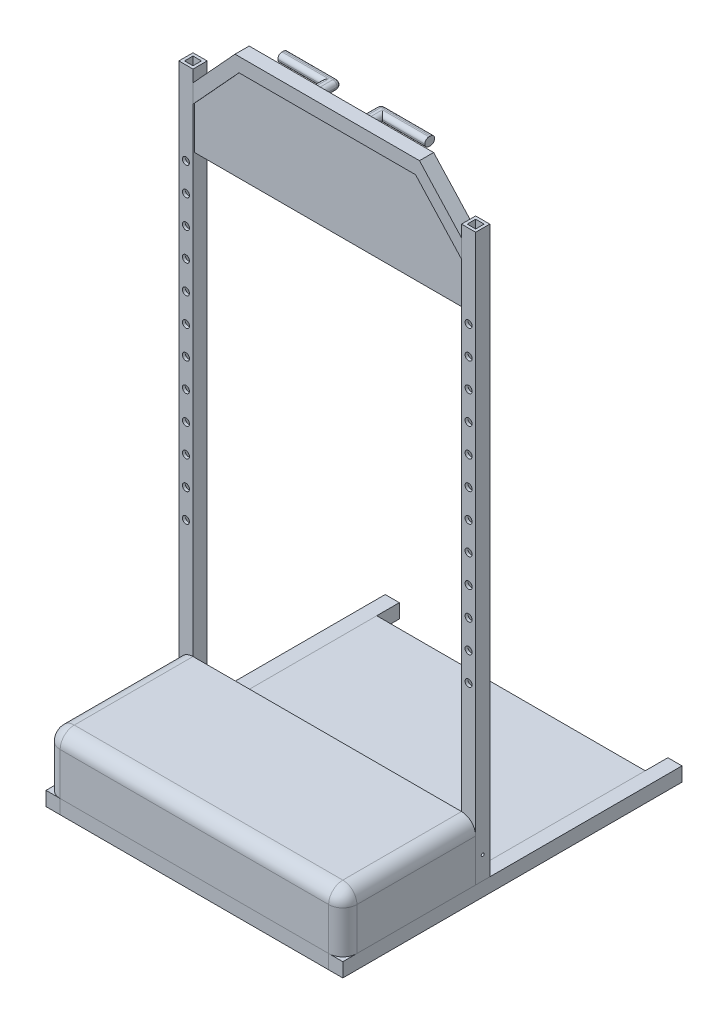
from build123d import *

# Parameters (mm, degrees)
SKETCH1_W               = 50
SKETCH1_H               = 1200
BOSS_EXTRUDE1_DEPTH     = 50
BOSS_EXTRUDE1_2_DEPTH   = 50
SKETCH2_W               = 950
SKETCH2_H               = 50
BOSS_EXTRUDE2_DEPTH     = 50
SKETCH3_W               = 50
SKETCH3_H               = 50
BOSS_EXTRUDE3_DEPTH     = 2000
BOSS_EXTRUDE3_2_DEPTH   = 2000
BOSS_EXTRUDE4_DEPTH     = 50
SKETCH8_W               = 30
SKETCH8_H               = 30
CUT_EXTRUDE1_DEPTH      = 1980
SKETCH9_W               = 1050
SKETCH9_H               = 470
BOSS_EXTRUDE5_DEPTH     = 200
SKETCH10_W              = 950
SKETCH10_H              = 50
BOSS_EXTRUDE7_DEPTH     = 320
SKETCH11_W              = 950
SKETCH11_H              = 50
BOSS_EXTRUDE8_DEPTH     = 100
FILLET1_R               = 50
FILLET2_R               = 50
FILLET3_R               = 50
SKETCH15_R              = 12.5
CUT_EXTRUDE4_DEPTH      = 50
BOSS_EXTRUDE13_DEPTH    = 45
SKETCH19_R              = 13.872950016
BOSS_EXTRUDE14_DEPTH    = 10
SKETCH19_R_2            = 11.261714239
BOSS_EXTRUDE14_2_DEPTH  = 10
SKETCH19_R_3            = 12.095962235
BOSS_EXTRUDE14_3_DEPTH  = 10
SKETCH19_R_4            = 25.497629654
SKETCH19_R_5            = 12.851526445
BOSS_EXTRUDE14_4_DEPTH  = 10
BOSS_EXTRUDE14_5_DEPTH  = 10
SKETCH19_W              = 28.160353525
SKETCH19_H              = 76.692026621
BOSS_EXTRUDE14_6_DEPTH  = 10
BOSS_EXTRUDE14_7_DEPTH  = 10
BOSS_EXTRUDE14_8_DEPTH  = 10
BOSS_EXTRUDE14_9_DEPTH  = 10
BOSS_EXTRUDE14_10_DEPTH = 10
BOSS_EXTRUDE14_11_DEPTH = 10
BOSS_EXTRUDE14_12_DEPTH = 10
BOSS_EXTRUDE14_13_DEPTH = 10
SKETCH19_W_2            = 9.553902
SKETCH19_H_2            = 46.983083585
BOSS_EXTRUDE14_14_DEPTH = 10
SKETCH25_W              = 40
SKETCH25_H              = 30
BOSS_EXTRUDE23_DEPTH    = 70
SKETCH28_W              = 35
SKETCH28_H              = 30
BOSS_EXTRUDE24_DEPTH    = 150
SKETCH29_W              = 35
SKETCH29_H              = 30
BOSS_EXTRUDE25_DEPTH    = 150
FILLET4_R               = 15
FILLET5_R               = 15
FILLET6_R               = 15
SKETCH30_W              = 25
SKETCH30_H              = 110
CUT_EXTRUDE5_DEPTH      = 100
SKETCH31_R              = 5.25
CUT_EXTRUDE6_DEPTH      = 55
SKETCH32_R              = 5.25
CUT_EXTRUDE7_DEPTH      = 55
SKETCH38_W              = 950
SKETCH38_H              = 650
BOSS_EXTRUDE31_DEPTH    = 35
SKETCH39_W              = 950
SKETCH39_H              = 650
BOSS_EXTRUDE33_DEPTH    = 15


# Some blends are built 0.0001 mm under size
with BuildPart() as part:
    # Sketch1 → Boss-Extrude1 (new body)
    with BuildSketch(Plane(origin=(0, 0, 0), x_dir=(1, 0, 0), z_dir=(0, 1, 0))):
        with Locations((-500, -551.538461538)):
            Rectangle(SKETCH1_W, SKETCH1_H)
    extrude(amount=BOSS_EXTRUDE1_DEPTH)


with BuildPart() as body_2:
    # Sketch1 → Boss-Extrude1 2 (new body)
    with BuildSketch(Plane(origin=(0, 0, 0), x_dir=(1, 0, 0), z_dir=(0, 1, 0))):
        with Locations((500, -551.538461538)):
            Rectangle(SKETCH1_W, SKETCH1_H)
    extrude(amount=BOSS_EXTRUDE1_2_DEPTH)


with BuildPart() as body_3:
    # Sketch2 → Boss-Extrude2 (new body)
    with BuildSketch(Plane.XZ):
        with Locations((0, 1026.538461538)):
            Rectangle(SKETCH2_W, SKETCH2_H)
    extrude(amount=-BOSS_EXTRUDE2_DEPTH)


with BuildPart() as body_4:
    # Sketch3 → Boss-Extrude3 (new body)
    with BuildSketch(Plane(origin=(0, 50, 0), x_dir=(1, 0, 0), z_dir=(0, 1, 0))):
        with Locations((-500, -656.538461538)):
            Rectangle(SKETCH3_W, SKETCH3_H)
    extrude(amount=BOSS_EXTRUDE3_DEPTH)


with BuildPart() as body_5:
    # Sketch3 → Boss-Extrude3 2 (new body)
    with BuildSketch(Plane(origin=(0, 50, 0), x_dir=(1, 0, 0), z_dir=(0, 1, 0))):
        with Locations((500, -656.538461538)):
            Rectangle(SKETCH3_W, SKETCH3_H)
    extrude(amount=BOSS_EXTRUDE3_2_DEPTH)


with BuildPart() as body_6:
    # Sketch6 → Boss-Extrude4 (new body)
    with BuildSketch(Plane(origin=(0, 0, 631.538461538), x_dir=(-1, 0, 0), z_dir=(0, 0, -1))):
        Polygon((475, 1942.633491709), (430.549586456, 1991.125611566), (312.41658097, 2120), (-312.431209368, 2120), (-442.530900604, 1978.058069606), (-475, 1942.633491709), (-475, 2007.818266571), (-326.349115906, 2170), (326.349115906, 2170), (475, 2007.818266571), align=None)
    extrude(amount=-BOSS_EXTRUDE4_DEPTH)

    # Sketch25 → Boss-Extrude23 (add)
    with BuildSketch(Plane(origin=(0, 0, 631.538461538), x_dir=(-1, 0, 0), z_dir=(0, 0, -1))):
        with Locations((-90.0036571, 2145)):
            Rectangle(SKETCH25_W, SKETCH25_H)
        with Locations((89.9963429, 2145)):
            Rectangle(SKETCH25_W, SKETCH25_H)
    extrude(amount=BOSS_EXTRUDE23_DEPTH)

    # Sketch28 → Boss-Extrude24 (add)
    with BuildSketch(Plane(origin=(110.0036571, 0, 0), x_dir=(0, 0, -1), z_dir=(1, 0, 0))):
        with Locations((-579.038461538, 2145)):
            Rectangle(SKETCH28_W, SKETCH28_H)
    extrude(amount=BOSS_EXTRUDE24_DEPTH)

    # Sketch29 → Boss-Extrude25 (add)
    with BuildSketch(Plane.ZY.offset(109.9963429)):
        with Locations((579.038461538, 2145)):
            Rectangle(SKETCH29_W, SKETCH29_H)
    extrude(amount=BOSS_EXTRUDE25_DEPTH)

    # Fillet4
    fillet4_edges = [body_6.edges().sort_by_distance(p)[0] for p in [
        (-109.9963429, 2130, 614.038461538),
        (-69.9963429, 2130, 596.538461538),
        (110.0036571, 2130, 614.038461538),
        (-69.9963429, 2160, 596.538461538),
        (-109.9963429, 2160, 614.038461538),
        (110.0036571, 2160, 614.038461538),
        (70.0036571, 2130, 596.538461538),
        (70.0036571, 2160, 596.538461538),
        (-184.9963429, 2160, 596.538461538),
        (-184.9963429, 2130, 596.538461538),
        (-164.9963429, 2130, 561.538461538),
        (-164.9963429, 2160, 561.538461538),
        (185.0036571, 2130, 596.538461538),
        (185.0036571, 2160, 596.538461538),
        (165.0036571, 2130, 561.538461538),
        (165.0036571, 2160, 561.538461538),
    ]]
    fillet(fillet4_edges, radius=FILLET4_R - 0.0001)  # a hair under: the kernel refuses the full size

    # Fillet5
    # the kernel refuses this fillet: 15 mm, written as the material it takes off along each edge
    with BuildSketch(Plane(origin=(85.0036571, 2160, 576.538461538), x_dir=(0, 0, -1), z_dir=(1, 0, 0))) as fillet5_piece_1:
        with BuildLine():
            CenterArc((0.0001, -14.9999), 14.9999, 0, 90)
            Line((15, -14.9999), (15, 0))
            Line((15, 0), (0.0001, 0))
        make_face()
    revolve(axis=Axis((85.0036571, 2160, 576.538461538), (0, 1, 0)), revolution_arc=90, mode=Mode.SUBTRACT)
    with BuildSketch(Plane(origin=(85.0036571, 2130, 576.538461538), x_dir=(-1, 0, 0), z_dir=(0, 0, 1))) as fillet5_piece_2:
        with BuildLine():
            CenterArc((0.0001, -14.9999), 14.9999, 0, 90)
            Line((15, -14.9999), (15, 0))
            Line((15, 0), (0.0001, 0))
        make_face()
    revolve(axis=Axis((85.0036571, 2130, 576.538461538), (0, -1, 0)), revolution_arc=90, mode=Mode.SUBTRACT)
    with BuildSketch(Plane(origin=(70.0036571, 2160, 561.538461538), x_dir=(0, 0, 1), z_dir=(0, -1, 0))) as fillet5_piece_3:
        with BuildLine():
            CenterArc((FILLET5_R, -FILLET5_R), FILLET5_R, 90, 90)
            Line((0, -FILLET5_R), (0, 0))
            Line((0, 0), (FILLET5_R, 0))
        make_face()
    extrude(amount=30, mode=Mode.SUBTRACT)

    # Fillet6
    # the kernel refuses this fillet: 15 mm, written as the material it takes off along each edge
    with BuildSketch(Plane(origin=(-84.9963429, 2160, 576.538461538), x_dir=(1, 0, 0), z_dir=(0, 0, 1))) as fillet6_piece_1:
        with BuildLine():
            CenterArc((0.0001, -14.9999), 14.9999, 0, 90)
            Line((15, -14.9999), (15, 0))
            Line((15, 0), (0.0001, 0))
        make_face()
    revolve(axis=Axis((-84.9963429, 2160, 576.538461538), (0, 1, 0)), revolution_arc=90, mode=Mode.SUBTRACT)
    with BuildSketch(Plane(origin=(-84.9963429, 2130, 576.538461538), x_dir=(0, 0, -1), z_dir=(-1, 0, 0))) as fillet6_piece_2:
        with BuildLine():
            CenterArc((0.0001, -14.9999), 14.9999, 0, 90)
            Line((15, -14.9999), (15, 0))
            Line((15, 0), (0.0001, 0))
        make_face()
    revolve(axis=Axis((-84.9963429, 2130, 576.538461538), (0, -1, 0)), revolution_arc=90, mode=Mode.SUBTRACT)
    with BuildSketch(Plane(origin=(-69.9963429, 2130, 561.538461538), x_dir=(0, 0, 1), z_dir=(0, 1, 0))) as fillet6_piece_3:
        with BuildLine():
            CenterArc((FILLET6_R, -FILLET6_R), FILLET6_R, 90, 90)
            Line((0, -FILLET6_R), (0, 0))
            Line((0, 0), (FILLET6_R, 0))
        make_face()
    extrude(amount=30, mode=Mode.SUBTRACT)


with BuildPart() as cut_extrude1_tool:
    # Sketch8 → Cut-Extrude1 (new body)
    with BuildSketch(Plane(origin=(0, 2050, 0), x_dir=(1, 0, 0), z_dir=(0, 1, 0))):
        with Locations((500, -656.538461538)):
            Rectangle(SKETCH8_W, SKETCH8_H)
        with Locations((-500, -656.538461538)):
            Rectangle(SKETCH8_W, SKETCH8_H)
    extrude(amount=-CUT_EXTRUDE1_DEPTH)


with BuildPart() as body_4_1:
    add(body_4.part)

    # Cut-Extrude1: cut by cut_extrude1_tool
    add(cut_extrude1_tool.part, mode=Mode.SUBTRACT)


with BuildPart() as body_5_1:
    add(body_5.part)

    # Cut-Extrude1: cut by cut_extrude1_tool
    add(cut_extrude1_tool.part, mode=Mode.SUBTRACT)


with BuildPart() as body_7:
    # Sketch9 → Boss-Extrude5 (new body)
    with BuildSketch(Plane(origin=(0, 50, 0), x_dir=(1, 0, 0), z_dir=(0, 1, 0))):
        with Locations((0, -916.538461538)):
            Rectangle(SKETCH9_W, SKETCH9_H)
    extrude(amount=BOSS_EXTRUDE5_DEPTH)

    # Fillet1
    fillet1_edges = [body_7.edges().sort_by_distance(p)[0] for p in [
        (0, 250, 1151.538461538),
    ]]
    fillet(fillet1_edges, radius=FILLET1_R)

    # Fillet2
    fillet2_edges = [body_7.edges().sort_by_distance(p)[0] for p in [
        (525, 250, 891.538461538),
        (525, 125, 1151.538461538),
        (525, 235.355339059, 1136.893800598),
    ]]
    fillet(fillet2_edges, radius=FILLET2_R)

    # Fillet3
    fillet3_edges = [body_7.edges().sort_by_distance(p)[0] for p in [
        (-525, 125, 1151.538461538),
        (-525, 235.355339059, 1136.893800598),
        (-525, 250, 891.538461538),
    ]]
    fillet(fillet3_edges, radius=FILLET3_R)


with BuildPart() as body_8:
    # Sketch10 → Boss-Extrude7 (new body)
    with BuildSketch(Plane(origin=(0, 0, 1001.538461538), x_dir=(-1, 0, 0), z_dir=(0, 0, -1))):
        with Locations((0, 25)):
            Rectangle(SKETCH10_W, SKETCH10_H)
    extrude(amount=BOSS_EXTRUDE7_DEPTH)


with BuildPart() as body_9:
    # Sketch11 → Boss-Extrude8 (new body)
    with BuildSketch(Plane.XY.offset(1051.538461538)):
        with Locations((0, 25)):
            Rectangle(SKETCH11_W, SKETCH11_H)
    extrude(amount=BOSS_EXTRUDE8_DEPTH)


with BuildPart() as cut_extrude4_tool:
    # Sketch15 → Cut-Extrude4 (new body)
    with BuildSketch(Plane(origin=(0, 0, 631.538461538), x_dir=(-1, 0, 0), z_dir=(0, 0, -1))):
        with BuildLine():
            ThreePointArc((-487.5, 1756.254548665), (-500, 1768.754548665), (-512.5, 1756.254548665))
            Line((-512.5, 1756.254548665), (-487.5, 1756.254548665))
        make_face()
        with BuildLine():
            Line((-487.5, 1756.254548665), (-512.5, 1756.254548665))
            ThreePointArc((-512.5, 1756.254548665), (-500, 1743.754548665), (-487.5, 1756.254548665))
        make_face()
        with Locations((-500, 1656.254548665)):
            Circle(SKETCH15_R)
        with Locations((-500, 1556.254548665)):
            Circle(SKETCH15_R)
        with Locations((-500, 1456.254548665)):
            Circle(SKETCH15_R)
        with Locations((-500, 1356.254548665)):
            Circle(SKETCH15_R)
        with Locations((-500, 1256.254548665)):
            Circle(SKETCH15_R)
        with Locations((-500, 1156.254548665)):
            Circle(SKETCH15_R)
        with Locations((-500, 1056.254548665)):
            Circle(SKETCH15_R)
        with BuildLine():
            ThreePointArc((512.5, 1756.254548665), (500, 1768.754548665), (487.5, 1756.254548665))
            Line((487.5, 1756.254548665), (512.5, 1756.254548665))
        make_face()
        with BuildLine():
            Line((512.5, 1756.254548665), (487.5, 1756.254548665))
            ThreePointArc((487.5, 1756.254548665), (500, 1743.754548665), (512.5, 1756.254548665))
        make_face()
        with Locations((500, 1656.254548665)):
            Circle(SKETCH15_R)
        with Locations((500, 1556.254548665)):
            Circle(SKETCH15_R)
        with Locations((500, 1456.254548665)):
            Circle(SKETCH15_R)
        with Locations((500, 1356.254548665)):
            Circle(SKETCH15_R)
        with Locations((-500, 956.254548665)):
            Circle(SKETCH15_R)
        with Locations((-500, 856.254548665)):
            Circle(SKETCH15_R)
        with Locations((-500, 756.254548665)):
            Circle(SKETCH15_R)
        with Locations((-500, 656.254548665)):
            Circle(SKETCH15_R)
        with Locations((500, 1256.254548665)):
            Circle(SKETCH15_R)
        with Locations((500, 1156.254548665)):
            Circle(SKETCH15_R)
        with Locations((500, 1056.254548665)):
            Circle(SKETCH15_R)
        with Locations((500, 956.254548665)):
            Circle(SKETCH15_R)
        with Locations((500, 856.254548665)):
            Circle(SKETCH15_R)
        with Locations((500, 756.254548665)):
            Circle(SKETCH15_R)
        with Locations((500, 656.254548665)):
            Circle(SKETCH15_R)
    extrude(amount=-CUT_EXTRUDE4_DEPTH)


with BuildPart() as body_4_2:
    add(body_4_1.part)

    # Cut-Extrude4: cut by cut_extrude4_tool
    add(cut_extrude4_tool.part, mode=Mode.SUBTRACT)


with BuildPart() as body_5_2:
    add(body_5_1.part)

    # Cut-Extrude4: cut by cut_extrude4_tool
    add(cut_extrude4_tool.part, mode=Mode.SUBTRACT)


with BuildPart() as body_10:
    # Sketch17 → Boss-Extrude13 (new body)
    with BuildSketch(Plane(origin=(0, 0, 631.538461538), x_dir=(-1, 0, 0), z_dir=(0, 0, -1))):
        Polygon((-475, 1942.633491709), (-475, 1792.199393469), (475, 1792.199393469), (475, 1942.633491709), (312.41658097, 2120), (-312.431209368, 2120), align=None)
    extrude(amount=-BOSS_EXTRUDE13_DEPTH)


with BuildPart() as body_11:
    # Sketch19 → Boss-Extrude14 (new body)
    with BuildSketch(Plane(origin=(0, 0, 631.538461538), x_dir=(-1, 0, 0), z_dir=(0, 0, -1))):
        with Locations((-127.032963832, 2031.122733015)):
            Circle(SKETCH19_R)
    extrude(amount=BOSS_EXTRUDE14_DEPTH)


with BuildPart() as body_12:
    # Sketch19 → Boss-Extrude14 2 (new body)
    with BuildSketch(Plane(origin=(0, 0, 631.538461538), x_dir=(-1, 0, 0), z_dir=(0, 0, -1))):
        with Locations((-199.489316183, 1851.962400951)):
            Circle(SKETCH19_R_2)
    extrude(amount=BOSS_EXTRUDE14_2_DEPTH)


with BuildPart() as body_13:
    # Sketch19 → Boss-Extrude14 3 (new body)
    with BuildSketch(Plane(origin=(0, 0, 631.538461538), x_dir=(-1, 0, 0), z_dir=(0, 0, -1))):
        with Locations((198.147588845, 1851.962400951)):
            Circle(SKETCH19_R_3)
    extrude(amount=BOSS_EXTRUDE14_3_DEPTH)


with BuildPart() as body_14:
    # Sketch19 → Boss-Extrude14 4 (new body)
    with BuildSketch(Plane(origin=(0, 0, 631.538461538), x_dir=(-1, 0, 0), z_dir=(0, 0, -1))):
        with Locations((115.435182788, 1851.962400951)):
            Circle(SKETCH19_R_4)
        with Locations((115.435182788, 1851.962400951)):
            Circle(SKETCH19_R_5, mode=Mode.SUBTRACT)
    extrude(amount=BOSS_EXTRUDE14_4_DEPTH)


with BuildPart() as body_15:
    # Sketch19 → Boss-Extrude14 5 (new body)
    with BuildSketch(Plane(origin=(0, 0, 631.538461538), x_dir=(-1, 0, 0), z_dir=(0, 0, -1))):
        Polygon((-272.328404892, 1988.766458193), (-272.328404892, 1912.074431572), (-242.370581993, 1912.074431572), (-242.370581993, 1960.905682897), (-180.357888592, 1960.905682897), (-180.357888592, 1988.766458193), align=None)
    extrude(amount=BOSS_EXTRUDE14_5_DEPTH)


with BuildPart() as body_16:
    # Sketch19 → Boss-Extrude14 6 (new body)
    with BuildSketch(Plane(origin=(0, 0, 631.538461538), x_dir=(-1, 0, 0), z_dir=(0, 0, -1))):
        with Locations((-127.032963833, 1950.420444883)):
            Rectangle(SKETCH19_W, SKETCH19_H)
    extrude(amount=BOSS_EXTRUDE14_6_DEPTH)


with BuildPart() as body_17:
    # Sketch19 → Boss-Extrude14 7 (new body)
    with BuildSketch(Plane(origin=(0, 0, 631.538461538), x_dir=(-1, 0, 0), z_dir=(0, 0, -1))):
        Polygon((-48.243889609, 2017.825546405), (-48.243889609, 1912.074431572), (-18.885223168, 1912.074431572), (-18.885223168, 2017.825546405), (17.064164311, 2017.825546405), (17.064164311, 2045.98589993), (-90.783998125, 2045.98589993), (-90.783998125, 2017.825546405), align=None)
    extrude(amount=BOSS_EXTRUDE14_7_DEPTH)


with BuildPart() as body_18:
    # Sketch19 → Boss-Extrude14 8 (new body)
    with BuildSketch(Plane(origin=(0, 0, 631.538461538), x_dir=(-1, 0, 0), z_dir=(0, 0, -1))):
        Polygon((71.877747221, 2017.825546405), (71.877747221, 1912.074431572), (99.773015751, 1912.074431572), (99.773015751, 2017.825546405), (142.350004559, 2017.825546405), (142.350004559, 2045.98589993), (33.460579157, 2045.98589993), (33.460579157, 2017.825546405), align=None)
    extrude(amount=BOSS_EXTRUDE14_8_DEPTH)


with BuildPart() as body_19:
    # Sketch19 → Boss-Extrude14 9 (new body)
    with BuildSketch(Plane(origin=(0, 0, 631.538461538), x_dir=(-1, 0, 0), z_dir=(0, 0, -1))):
        with BuildLine():
            Line((160.702154908, 1988.766458193), (160.702154908, 1912.074431572))
            Line((160.702154908, 1912.074431572), (187.373946748, 1912.074431572))
            Line((187.373946748, 1912.074431572), (187.373946748, 1958.750849803))
            ThreePointArc((187.373946748, 1958.750849803), (192.06601131, 1963.30188004), (198.147588845, 1960.905682897))
            Line((198.147588845, 1960.905682897), (242.016569038, 1912.074431572))
            Line((242.016569038, 1912.074431572), (275.941913721, 1912.074431572))
            Line((275.941913721, 1912.074431572), (232.072933528, 1960.905682897))
            ThreePointArc((232.072933528, 1960.905682897), (272.730878669, 2003.445791413), (232.072933528, 2045.98589993))
            Line((232.072933528, 2045.98589993), (160.702154908, 2045.98589993))
            Line((160.702154908, 2045.98589993), (160.702154908, 2017.825546405))
            Line((160.702154908, 2017.825546405), (232.072933528, 2017.825546405))
            ThreePointArc((232.072933528, 2017.825546405), (243.71530311, 2003.296002299), (232.072933528, 1988.766458193))
            Line((232.072933528, 1988.766458193), (160.702154908, 1988.766458193))
        make_face()
    extrude(amount=BOSS_EXTRUDE14_9_DEPTH)


with BuildPart() as body_20:
    # Sketch19 → Boss-Extrude14 10 (new body)
    with BuildSketch(Plane(origin=(0, 0, 631.538461538), x_dir=(-1, 0, 0), z_dir=(0, 0, -1))):
        with BuildLine():
            Line((-272.328404892, 2003.429645733), (-246.670286028, 2003.429645733))
            ThreePointArc((-246.670286028, 2003.429645733), (-239.268889638, 2014.02773476), (-226.91264481, 2017.825546405))
            Line((-226.91264481, 2017.825546405), (-163.75297206, 2017.825546405))
            Line((-163.75297206, 2017.825546405), (-163.75297206, 2045.98589993))
            Line((-163.75297206, 2045.98589993), (-226.912644809, 2045.98589993))
            Line((-226.912644809, 2045.98589993), (-238.734839965, 2045.98589993))
            ThreePointArc((-238.734839965, 2045.98589993), (-264.103032071, 2031.473974692), (-272.328404892, 2003.429645733))
        make_face()
    extrude(amount=BOSS_EXTRUDE14_10_DEPTH)


with BuildPart() as body_21:
    # Sketch19 → Boss-Extrude14 11 (new body)
    with BuildSketch(Plane(origin=(0, 0, 631.538461538), x_dir=(-1, 0, 0), z_dir=(0, 0, -1))):
        with BuildLine():
            Line((-136.977925312, 1873.463134117), (-136.977925312, 1826.480050532))
            Line((-136.977925312, 1826.480050532), (-109.902927992, 1826.480050532))
            ThreePointArc((-109.902927992, 1826.480050532), (-98.612469798, 1836.965351507), (-102.148638735, 1851.962400951))
            ThreePointArc((-102.148638735, 1851.962400951), (-100.276299584, 1864.786332187), (-109.902927992, 1873.463134117))
            Line((-109.902927992, 1873.463134117), (-136.977925312, 1873.463134117))
        make_face()
        with BuildLine():
            Line((-125.175267733, 1862.598979878), (-125.175267733, 1856.531151967))
            Line((-125.175267733, 1856.531151967), (-112.95278707, 1856.531151967))
            ThreePointArc((-112.95278707, 1856.531151967), (-109.850175983, 1859.565065922), (-112.95278707, 1862.598979878))
            Line((-112.95278707, 1862.598979878), (-125.175267733, 1862.598979878))
        make_face(mode=Mode.SUBTRACT)
        with BuildLine():
            Line((-125.175267733, 1845.951349454), (-125.175267733, 1839.57235088))
            Line((-125.175267733, 1839.57235088), (-112.95278707, 1839.57235088))
            Line((-112.95278707, 1839.57235088), (-109.902927992, 1839.57235088))
            ThreePointArc((-109.902927992, 1839.57235088), (-107.808637054, 1842.761850167), (-109.902927992, 1845.951349454))
            Line((-109.902927992, 1845.951349454), (-112.95278707, 1845.951349454))
            Line((-112.95278707, 1845.951349454), (-125.175267733, 1845.951349454))
        make_face(mode=Mode.SUBTRACT)
    extrude(amount=BOSS_EXTRUDE14_11_DEPTH)


with BuildPart() as body_22:
    # Sketch19 → Boss-Extrude14 12 (new body)
    with BuildSketch(Plane(origin=(0, 0, 631.538461538), x_dir=(-1, 0, 0), z_dir=(0, 0, -1))):
        Polygon((-85.034252317, 1873.463134117), (-66.675183251, 1842.761850167), (-66.675183251, 1826.480050532), (-57.495648718, 1826.480050532), (-57.495648718, 1842.761850167), (-41.470359618, 1873.463134117), (-50.184330229, 1873.463134117), (-62.085415985, 1858.112492142), (-75.854717784, 1873.463134117), align=None)
    extrude(amount=BOSS_EXTRUDE14_12_DEPTH)


with BuildPart() as body_23:
    # Sketch19 → Boss-Extrude14 13 (new body)
    with BuildSketch(Plane(origin=(0, 0, 631.538461538), x_dir=(-1, 0, 0), z_dir=(0, 0, -1))):
        with BuildLine():
            Line((4.708619391, 1873.463134117), (4.708619391, 1826.480050532))
            Line((4.708619391, 1826.480050532), (13.228360596, 1826.480050532))
            Line((13.228360596, 1826.480050532), (13.228360596, 1839.57235088))
            ThreePointArc((13.228360596, 1839.57235088), (17.6621462, 1841.265735094), (22.095931804, 1839.57235088))
            Line((22.095931804, 1839.57235088), (33.460579157, 1826.480050532))
            Line((33.460579157, 1826.480050532), (45.440627673, 1826.480050532))
            Line((45.440627673, 1826.480050532), (32.467727531, 1841.425090159))
            ThreePointArc((32.467727531, 1841.425090159), (43.188436735, 1859.056248569), (28.415725354, 1873.463134117))
            Line((28.415725354, 1873.463134117), (4.708619391, 1873.463134117))
        make_face()
        with BuildLine():
            Line((15.265690015, 1862.598979878), (15.265690015, 1851.962400951))
            Line((15.265690015, 1851.962400951), (26.007972405, 1851.962400951))
            ThreePointArc((26.007972405, 1851.962400951), (31.399297294, 1857.280690415), (26.007972405, 1862.598979878))
            Line((26.007972405, 1862.598979878), (15.265690015, 1862.598979878))
        make_face(mode=Mode.SUBTRACT)
    extrude(amount=BOSS_EXTRUDE14_13_DEPTH)


with BuildPart() as body_24:
    # Sketch19 → Boss-Extrude14 14 (new body)
    with BuildSketch(Plane(origin=(0, 0, 631.538461538), x_dir=(-1, 0, 0), z_dir=(0, 0, -1))):
        with Locations((67.100796221, 1849.971592325)):
            Rectangle(SKETCH19_W_2, SKETCH19_H_2)
    extrude(amount=BOSS_EXTRUDE14_14_DEPTH)


with BuildPart() as cut_extrude5_tool:
    # Sketch30 → Cut-Extrude5 (new body)
    with BuildSketch(Plane(origin=(0, 0, 631.538461538), x_dir=(-1, 0, 0), z_dir=(0, 0, -1))):
        with Locations((-500, 130)):
            Rectangle(SKETCH30_W, SKETCH30_H)
        with Locations((500, 130)):
            Rectangle(SKETCH30_W, SKETCH30_H)
    extrude(amount=-CUT_EXTRUDE5_DEPTH)


with BuildPart() as body_5_3:
    add(body_5_2.part)

    # Cut-Extrude5: cut by cut_extrude5_tool
    add(cut_extrude5_tool.part, mode=Mode.SUBTRACT)

    # Sketch31 → Cut-Extrude6 (cut)
    with BuildSketch(Plane(origin=(525, 0, 0), x_dir=(0, 0, -1), z_dir=(1, 0, 0))):
        with Locations((-656.538461538, 130)):
            Circle(SKETCH31_R)
    extrude(amount=-CUT_EXTRUDE6_DEPTH, mode=Mode.SUBTRACT)


with BuildPart() as body_4_3:
    add(body_4_2.part)

    # Cut-Extrude5: cut by cut_extrude5_tool
    add(cut_extrude5_tool.part, mode=Mode.SUBTRACT)

    # Sketch32 → Cut-Extrude7 (cut)
    with BuildSketch(Plane.ZY.offset(525)):
        with Locations(Location((656.538461538, 130, 0), (0, 0, 180))):
            Circle(SKETCH32_R)
    extrude(amount=-CUT_EXTRUDE7_DEPTH, mode=Mode.SUBTRACT)


with BuildPart() as body_25:
    # Sketch38 → Boss-Extrude31 (new body)
    with BuildSketch(Plane.XZ):
        with Locations((0, 356.538461538)):
            Rectangle(SKETCH38_W, SKETCH38_H)
    extrude(amount=-BOSS_EXTRUDE31_DEPTH)


with BuildPart() as body_26:
    # Sketch39 → Boss-Extrude33 (new body)
    with BuildSketch(Plane(origin=(0, 35, 0), x_dir=(1, 0, 0), z_dir=(0, 1, 0))):
        with Locations((0, -356.538461538)):
            Rectangle(SKETCH39_W, SKETCH39_H)
    extrude(amount=BOSS_EXTRUDE33_DEPTH)


solid = Compound([part.part, body_2.part, body_3.part, body_6.part, body_7.part, body_8.part, body_9.part, body_10.part, body_11.part, body_12.part, body_13.part, body_14.part, body_15.part, body_16.part, body_17.part, body_18.part, body_19.part, body_20.part, body_21.part, body_22.part, body_23.part, body_24.part, body_5_3.part, body_4_3.part, body_25.part, body_26.part])
